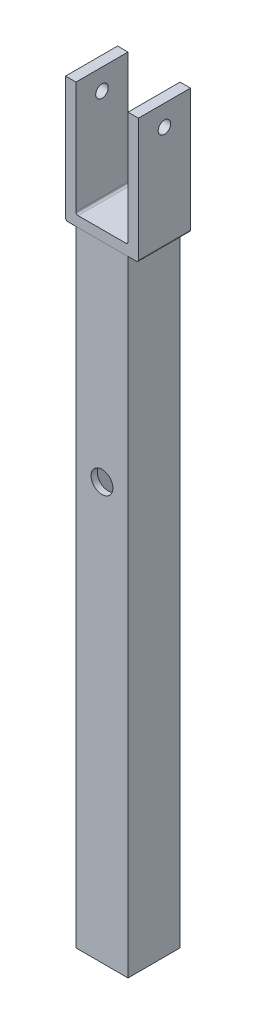
from build123d import *

# Parameters (mm, degrees)
SKETCH1_W           = 25
SKETCH1_H           = 25
SKETCH1_W_2         = 19
SKETCH1_H_2         = 19
BOSS_EXTRUDE1_DEPTH = 300
SKETCH2_R           = 7.5
CUT_EXTRUDE1_DEPTH  = 3
SKETCH3_R           = 5.25
CUT_EXTRUDE2_DEPTH  = 3
SKETCH5_W           = 35
SKETCH5_H           = 25
BOSS_EXTRUDE2_DEPTH = 60
SKETCH7_W           = 25
SKETCH7_H           = 25
CUT_EXTRUDE4_DEPTH  = 55
SKETCH8_R           = 3
CUT_EXTRUDE5_DEPTH  = 55
FILLET1_R           = 1
FILLET2_R           = 1


with BuildPart() as part:
    # Sketch1 → Boss-Extrude1 (new body)
    with BuildSketch(Plane(origin=(0, 0, 0), x_dir=(1, 0, 0), z_dir=(0, 1, 0))):
        Rectangle(SKETCH1_W, SKETCH1_H)
        Rectangle(SKETCH1_W_2, SKETCH1_H_2, mode=Mode.SUBTRACT)
    extrude(amount=BOSS_EXTRUDE1_DEPTH)

    # Sketch2 → Cut-Extrude1 (cut)
    with BuildSketch(Plane(origin=(0, 0, -12.5), x_dir=(-1, 0, 0), z_dir=(0, 0, -1))):
        with Locations((0, 200)):
            Circle(SKETCH2_R)
    extrude(amount=-CUT_EXTRUDE1_DEPTH, mode=Mode.SUBTRACT)

    # Sketch3 → Cut-Extrude2 (cut)
    with BuildSketch(Plane.XY.offset(12.5)):
        with Locations((0, 200)):
            Circle(SKETCH3_R)
    extrude(amount=-CUT_EXTRUDE2_DEPTH, mode=Mode.SUBTRACT)


with BuildPart() as body_2:
    # Sketch5 → Boss-Extrude2 (new body)
    with BuildSketch(Plane(origin=(0, 300, 0), x_dir=(1, 0, 0), z_dir=(0, 1, 0))):
        Rectangle(SKETCH5_W, SKETCH5_H)
    extrude(amount=BOSS_EXTRUDE2_DEPTH)

    # Sketch7 → Cut-Extrude4 (cut)
    with BuildSketch(Plane(origin=(0, 360, 0), x_dir=(1, 0, 0), z_dir=(0, 1, 0))):
        Rectangle(SKETCH7_W, SKETCH7_H)
    extrude(amount=-CUT_EXTRUDE4_DEPTH, mode=Mode.SUBTRACT)

    # Sketch8 → Cut-Extrude5 (cut)
    with BuildSketch(Plane.ZY.offset(17.5)):
        with Locations((0, 350)):
            Circle(SKETCH8_R)
    extrude(amount=-CUT_EXTRUDE5_DEPTH, mode=Mode.SUBTRACT)

    # Fillet1
    fillet1_edges = [body_2.edges().sort_by_distance(p)[0] for p in [
        (12.5, 305, 0),
        (-12.5, 305, 0),
    ]]
    fillet(fillet1_edges, radius=FILLET1_R)

    # Fillet2
    fillet2_edges = [body_2.edges().sort_by_distance(p)[0] for p in [
        (17.5, 300, 0),
        (-17.5, 300, 0),
    ]]
    fillet(fillet2_edges, radius=FILLET2_R)


solid = Compound([part.part, body_2.part])
